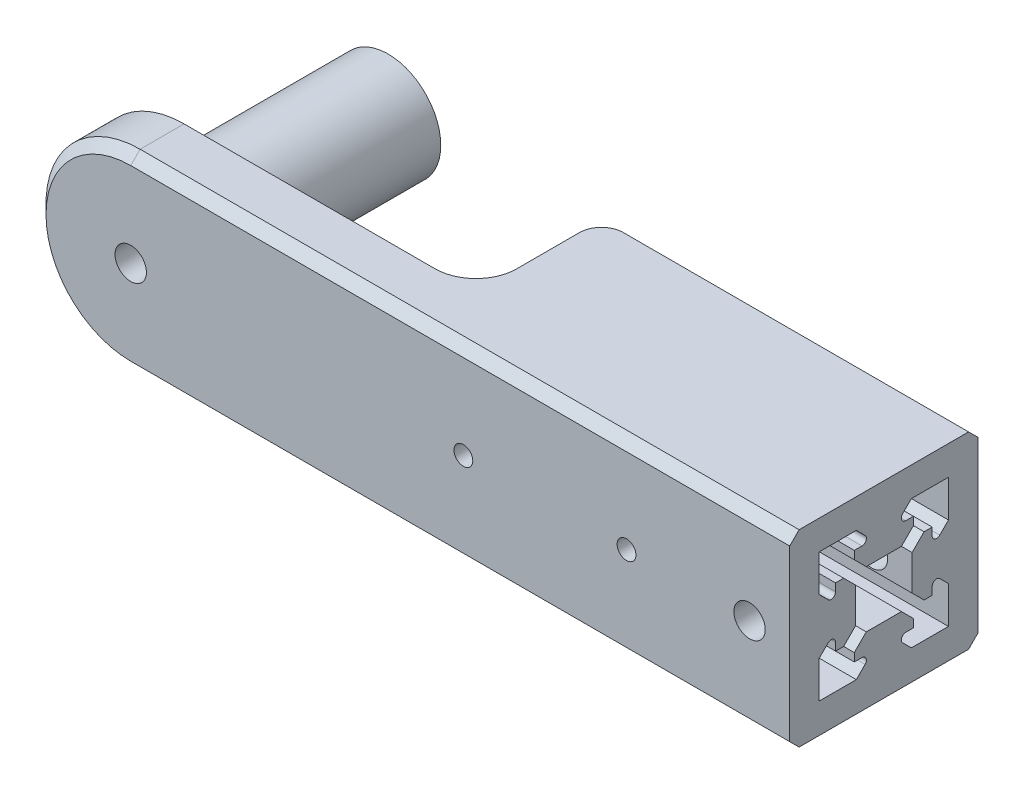
from build123d import *

# Parameters (mm, degrees)
SKETCH1_R           = 8.4
BOSS_EXTRUDE1_DEPTH = 30
SKETCH3_R           = 10
BOSS_EXTRUDE2_DEPTH = 1
BOSS_EXTRUDE3_DEPTH = 10
BOSS_EXTRUDE4_DEPTH = 30
CUT_EXTRUDE1_DEPTH  = 66
CHAMFER1_SIZE       = 1.5
SKETCH7_R           = 1.5
SKETCH7_R_2         = 2.5
CUT_EXTRUDE2_DEPTH  = 114.714555009


with BuildPart() as part:
    # Sketch1 → Boss-Extrude1 (new body)
    with BuildSketch(Plane.XY):
        Circle(SKETCH1_R)
    extrude(amount=BOSS_EXTRUDE1_DEPTH)

    # Sketch3 → Boss-Extrude2 (add)
    with BuildSketch(Plane.XY.offset(30)):
        Circle(SKETCH3_R)
    extrude(amount=BOSS_EXTRUDE2_DEPTH)

    # Sketch4 → Boss-Extrude3 (add)
    with BuildSketch(Plane.XY.offset(31)):
        with BuildLine():
            Line((0, 15), (105, 15))
            Line((105, 15), (105, -15))
            Line((105, -15), (0, -15))
            ThreePointArc((0, -15), (-15, 0), (0, 15))
        make_face()
    extrude(amount=BOSS_EXTRUDE3_DEPTH)

    # Sketch5 → Boss-Extrude4 (add)
    with BuildSketch(Plane(origin=(0, 15, 0), x_dir=(1, 0, 0), z_dir=(0, 1, 0))):
        with BuildLine():
            Line((40, -31), (105, -31))
            Line((105, -31), (105, -11))
            Line((105, -11), (50, -11))
            ThreePointArc((50, -11), (46.464466094, -12.464466094), (45, -16))
            Line((45, -16), (45, -26))
            ThreePointArc((45, -26), (43.535533906, -29.535533906), (40, -31))
        make_face()
    extrude(amount=-BOSS_EXTRUDE4_DEPTH)

    # Sketch6 → Cut-Extrude1 (cut)
    with BuildSketch(Plane(origin=(105, 0, 0), x_dir=(0, 0, -1), z_dir=(1, 0, 0))):
        with BuildLine():
            Line((-23.197056275, 4.553712276), (-28.802943725, 4.553712276))
            Line((-28.802943725, 4.553712276), (-30.710050506, 6.460819058))
            Line((-30.710050506, 6.460819058), (-30.710050506, 7.753712276))
            Line((-30.710050506, 7.753712276), (-29.482842712, 7.753712276))
            ThreePointArc((-29.482842712, 7.753712276), (-28.83612704, 8.185833874), (-28.987867966, 8.948687023))
            Line((-28.987867966, 8.948687023), (-30.387867966, 10.348687023))
            Line((-30.387867966, 10.348687023), (-36.294974747, 10.348687023))
            Line((-36.294974747, 10.348687023), (-36.294974747, 4.441580242))
            Line((-36.294974747, 4.441580242), (-34.894974747, 3.041580242))
            ThreePointArc((-34.894974747, 3.041580242), (-34.132121597, 2.889839316), (-33.7, 3.536554989))
            Line((-33.7, 3.536554989), (-33.7, 4.763762783))
            Line((-33.7, 4.763762783), (-32.407106781, 4.763762783))
            Line((-32.407106781, 4.763762783), (-30.5, 2.856656002))
            Line((-30.5, 2.856656002), (-30.5, -2.749231449))
            Line((-30.5, -2.749231449), (-32.407106781, -4.65633823))
            Line((-32.407106781, -4.65633823), (-33.7, -4.65633823))
            Line((-33.7, -4.65633823), (-33.7, -3.429130436))
            ThreePointArc((-33.7, -3.429130436), (-34.132121597, -2.782414763), (-34.894974747, -2.934155689))
            Line((-34.894974747, -2.934155689), (-36.294974747, -4.334155689))
            Line((-36.294974747, -4.334155689), (-36.294974747, -10.24126247))
            Line((-36.294974747, -10.24126247), (-30.387867966, -10.24126247))
            Line((-30.387867966, -10.24126247), (-28.987867966, -8.84126247))
            ThreePointArc((-28.987867966, -8.84126247), (-28.83612704, -8.078409321), (-29.482842712, -7.646287724))
            Line((-29.482842712, -7.646287724), (-30.710050506, -7.646287724))
            Line((-30.710050506, -7.646287724), (-30.710050506, -6.353394505))
            Line((-30.710050506, -6.353394505), (-28.802943725, -4.446287724))
            Line((-28.802943725, -4.446287724), (-23.197056275, -4.446287724))
            Line((-23.197056275, -4.446287724), (-21.289949494, -6.353394505))
            Line((-21.289949494, -6.353394505), (-21.289949494, -7.646287724))
            Line((-21.289949494, -7.646287724), (-22.517157288, -7.646287724))
            ThreePointArc((-22.517157288, -7.646287724), (-23.16387296, -8.078409321), (-23.012132034, -8.84126247))
            Line((-23.012132034, -8.84126247), (-21.612132034, -10.24126247))
            Line((-21.612132034, -10.24126247), (-15.705025253, -10.24126247))
            Line((-15.705025253, -10.24126247), (-15.705025253, -4.334155689))
            Line((-15.705025253, -4.334155689), (-17.105025253, -2.934155689))
            ThreePointArc((-17.105025253, -2.934155689), (-17.867878403, -2.782414763), (-18.3, -3.429130436))
            Line((-18.3, -3.429130436), (-18.3, -4.65633823))
            Line((-18.3, -4.65633823), (-19.592893219, -4.65633823))
            Line((-19.592893219, -4.65633823), (-21.5, -2.749231449))
            Line((-21.5, -2.749231449), (-21.5, 2.856656002))
            Line((-21.5, 2.856656002), (-19.592893219, 4.763762783))
            Line((-19.592893219, 4.763762783), (-18.3, 4.763762783))
            Line((-18.3, 4.763762783), (-18.3, 3.536554989))
            ThreePointArc((-18.3, 3.536554989), (-17.867878403, 2.889839316), (-17.105025253, 3.041580242))
            Line((-17.105025253, 3.041580242), (-15.705025253, 4.441580242))
            Line((-15.705025253, 4.441580242), (-15.705025253, 10.348687023))
            Line((-15.705025253, 10.348687023), (-21.612132034, 10.348687023))
            Line((-21.612132034, 10.348687023), (-23.012132034, 8.948687023))
            ThreePointArc((-23.012132034, 8.948687023), (-23.16387296, 8.185833874), (-22.517157288, 7.753712276))
            Line((-22.517157288, 7.753712276), (-21.289949494, 7.753712276))
            Line((-21.289949494, 7.753712276), (-21.289949494, 6.460819058))
            Line((-21.289949494, 6.460819058), (-23.197056275, 4.553712276))
        make_face()
    extrude(amount=-CUT_EXTRUDE1_DEPTH, mode=Mode.SUBTRACT)

    # Chamfer1
    chamfer1_edges = [part.edges().sort_by_distance(p)[0] for p in [
        (77.5, -15, 11),
        (46.464466094, -15, 12.464466094),
        (45, -15, 21),
        (43.535533906, -15, 29.535533906),
        (20, -15, 31),
        (-15, 0, 31),
        (20, 15, 31),
        (43.535533906, 15, 29.535533906),
        (45, 15, 21),
        (46.464466094, 15, 12.464466094),
        (77.5, 15, 11),
        (52.5, -15, 41),
        (-15, 0, 41),
        (52.5, 15, 41),
    ]]
    chamfer(chamfer1_edges, length=CHAMFER1_SIZE)

    # Sketch7 → Cut-Extrude2 (cut, through all)
    with BuildSketch(Plane.XY.offset(41)):
        with Locations((53, 0)):
            Circle(SKETCH7_R)
        with Locations((79, 0)):
            Circle(SKETCH7_R)
        with Locations((98.6, 0)):
            Circle(SKETCH7_R_2)
        Circle(SKETCH7_R_2)
    extrude(amount=-CUT_EXTRUDE2_DEPTH, mode=Mode.SUBTRACT)


solid = part.part
